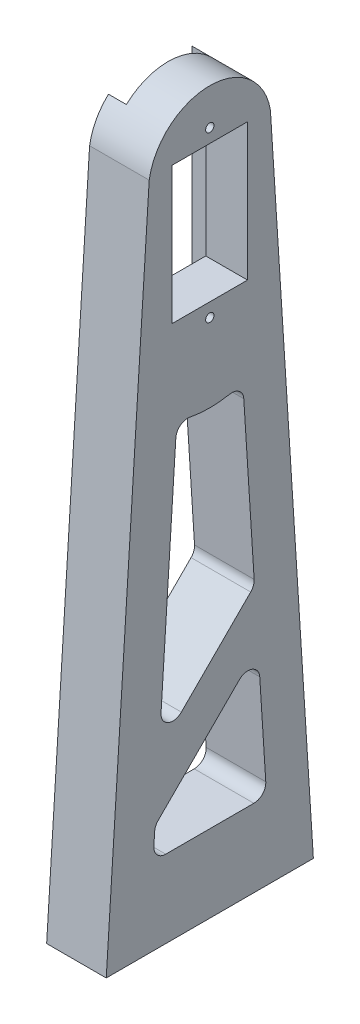
from build123d import *

# Parameters (mm, degrees)
STOCK_FRAME_1_START       = 97.5
STOCK_FRAME_1_DEPTH       = 10
STOCK_FRAME_1_START_2     = 100.5
STOCK_FRAME_1_2_OUTLINE_R = 0.7
STOCK_FRAME_1_2_OUTLINE_W = 23
STOCK_FRAME_1_2_OUTLINE_H = 12.65
STOCK_FRAME_1_2_DEPTH     = 7
CUT_EXTRUDE1_DEPTH        = 128.596397383
CUT_EXTRUDE1_DEPTH_BACK   = 128.596397383
SKETCH1_W                 = 49.919710218
SKETCH1_H                 = 2
CUT_EXTRUDE2_DEPTH        = 10
FILLET1_R                 = 0.5


# Read off the part's stored shape, not the designer's step: Stock-frame-1
with BuildPart() as part:
    # Stock-frame-1 outline → Stock-frame-1 (new body)
    with BuildSketch(Plane.YZ.offset(STOCK_FRAME_1_START)):
        with BuildLine():
            Line((-4.096596213, 2.525), (-38.259818101, 2.525))
            Line((-38.259818101, 2.525), (-38.259818101, 16.525))
            Line((-38.259818101, 16.525), (-4.096596213, 16.525))
            ThreePointArc((-4.096596213, 16.525), (-6.783664239, 18.601647078), (-10, 19.69159292))
            Line((-10, 19.69159292), (-124.3, 27.025))
            Line((-124.3, 27.025), (-124.3, -7.975))
            Line((-124.3, -7.975), (-10, -0.64159292))
            ThreePointArc((-10, -0.64159292), (-6.783664239, 0.448352922), (-4.096596213, 2.525))
        make_face()
        with BuildLine():
            ThreePointArc((-109.3, 16.915787193), (-108.668190305, 18.374572746), (-107.17194471, 18.911683443))
            Line((-107.17194471, 18.911683443), (-105.052772964, 18.775718884))
            ThreePointArc((-105.052772964, 18.775718884), (-104.356669901, 18.602118716), (-103.766614692, 18.194036196))
            Line((-103.766614692, 18.194036196), (-90.131771322, 4.559192826))
            ThreePointArc((-90.131771322, 4.559192826), (-89.674659008, 2.439189307), (-91.417929594, 1.149083013))
            Line((-91.417929594, 1.149083013), (-107.17194471, 0.138316557))
            ThreePointArc((-107.17194471, 0.138316557), (-108.668190305, 0.675427254), (-109.3, 2.134212807))
            Line((-109.3, 2.134212807), (-109.3, 16.915787193))
        make_face(mode=Mode.SUBTRACT)
        with BuildLine():
            ThreePointArc((-49.680780162, 15.223091028), (-48.224999236, 14.448449394), (-47.845976598, 12.84354765))
            ThreePointArc((-47.845976598, 12.84354765), (-48.167247509, 9.525), (-47.845976598, 6.20645235))
            ThreePointArc((-47.845976598, 6.20645235), (-48.224999236, 4.601550606), (-49.680780162, 3.826908972))
            Line((-49.680780162, 3.826908972), (-76.799489195, 2.0869918))
            ThreePointArc((-76.799489195, 2.0869918), (-77.633334442, 2.211562173), (-78.341758047, 2.668674488))
            Line((-78.341758047, 2.668674488), (-89.972181694, 14.299098134))
            ThreePointArc((-89.972181694, 14.299098134), (-90.380264213, 16.53747005), (-88.429912841, 17.709207947))
            Line((-88.429912841, 17.709207947), (-49.680780162, 15.223091028))
        make_face(mode=Mode.SUBTRACT)
    extrude(amount=STOCK_FRAME_1_DEPTH)

    # Stock-frame-1 2 outline → Stock-frame-1 2 (add)
    with BuildSketch(Plane.YZ.offset(STOCK_FRAME_1_START_2)):
        with BuildLine():
            Line((-38.259818101, 16.525), (-38.259818101, 2.525))
            Line((-38.259818101, 2.525), (-4.096596213, 2.525))
            ThreePointArc((-4.096596213, 2.525), (-1.352388693, 9.525), (-4.096596213, 16.525))
            Line((-4.096596213, 16.525), (-38.259818101, 16.525))
        make_face()
        with Locations((-35.059818101, 9.525)):
            Circle(STOCK_FRAME_1_2_OUTLINE_R, mode=Mode.SUBTRACT)
        with Locations((-21.259818101, 9.525)):
            Rectangle(STOCK_FRAME_1_2_OUTLINE_W, STOCK_FRAME_1_2_OUTLINE_H, mode=Mode.SUBTRACT)
        with Locations((-7.459818101, 9.525)):
            Circle(STOCK_FRAME_1_2_OUTLINE_R, mode=Mode.SUBTRACT)
    extrude(amount=STOCK_FRAME_1_2_DEPTH)

    # Sketch1 → Cut-Extrude1 (cut, two sides: drawn at the far end of the back side and taken through both)
    with BuildSketch(Plane(origin=(107.5, 0, 0), x_dir=(0, 0, -1), z_dir=(1, 0, 0)).offset(-CUT_EXTRUDE1_DEPTH_BACK)):
        with Locations((-2.065144891, -123.3)):
            Rectangle(SKETCH1_W, SKETCH1_H)
    extrude(amount=CUT_EXTRUDE1_DEPTH + CUT_EXTRUDE1_DEPTH_BACK, mode=Mode.SUBTRACT)

    # Sketch2 → Cut-Extrude2 (cut)
    with BuildSketch(Plane.XZ.offset(122.3)):
        Polygon((97.5, 12.525), (103.5, 14.525), (103.5, 4.525), (97.5, 6.525), align=None)
    extrude(amount=-CUT_EXTRUDE2_DEPTH, mode=Mode.SUBTRACT)

    # Fillet1
    fillet1_edges = [part.edges().sort_by_distance(p)[0] for p in [
        (97.5, -117.3, 6.525),
        (97.5, -117.3, 12.525),
    ]]
    fillet(fillet1_edges, radius=FILLET1_R)


solid = part.part
